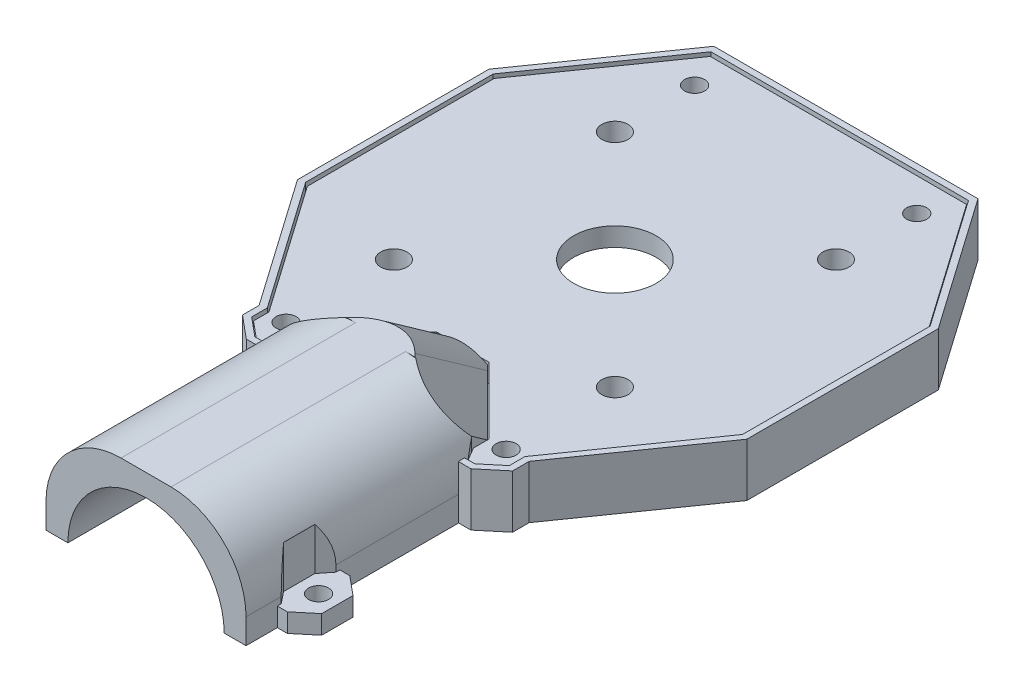
from build123d import *
from build123d.topology import SkipClean

# Parameters (mm, degrees)
BOSS_EXTRUDE1_DEPTH      = 40
BOSS_EXTRUDE3_DEPTH      = 3
CUT_EXTRUDE5_DEPTH       = 17
BOSS_EXTRUDE4_OUTLINE_R  = 1.6
BOSS_EXTRUDE4_DEPTH      = 5
CUT_EXTRUDE7_DEPTH       = 40
BOSS_EXTRUDE5_DEPTH      = 11
CUT_EXTRUDE8_DEPTH       = 3
BOSS_EXTRUDE7_DEPTH      = 3.5
BOSS_EXTRUDE7_DEPTH_BACK = 5
SKETCH13_R               = 1.6
SKETCH13_R_2             = 2.1
SKETCH13_R_3             = 6.6
BOSS_EXTRUDE8_DEPTH      = 3
CHAMFER1_SIZE            = 8.2
FILLET1_R                = 10
BOSS_EXTRUDE9_DEPTH      = 10


# Read off the part's stored shape, not the designer's step: Boss-Extrude4
with BuildPart() as part:
    # Sketch1 → Boss-Extrude1 (new body)
    with BuildSketch(Plane.XY):
        with BuildLine():
            ThreePointArc((-12.5, 0), (0, 12.5), (12.5, 0))
            Line((12.5, 0), (16, 0))
            Line((16, 0), (16, 4))
            ThreePointArc((16, 4), (12.485281374, 12.485281374), (4, 16))
            Line((4, 16), (-4, 16))
            ThreePointArc((-4, 16), (-12.485281374, 12.485281374), (-16, 4))
            Line((-16, 4), (-16, 0))
            Line((-16, 0), (-12.5, 0))
        make_face()
    extrude(amount=-BOSS_EXTRUDE1_DEPTH)

    # Sketch3 → Boss-Extrude3 (add)
    with SkipClean():  # the faces are left unmerged after this step: merging them gives an invalid solid
        with BuildSketch(Plane(origin=(0, 0, 0), x_dir=(1, 0, 0), z_dir=(0, 1, 0))):
            Polygon((16, 10.000000005), (16, 6.333333333), (16, 5), (17.6, 5), (20.6, 7.5), (20.6, 12.5), (17.6, 15), (16, 15), (16, 13.666666667), align=None)
            with BuildLine():
                ThreePointArc((19.2, 10), (17.599999997, 8.4), (16, 10.000000005))
                ThreePointArc((16, 10.000000005), (17.600000003, 11.6), (19.2, 10))
            make_face(mode=Mode.SUBTRACT)
        boss_extrude3 = extrude(amount=BOSS_EXTRUDE3_DEPTH)

    # Sketch5 → Cut-Extrude5 (cut)
    with BuildSketch(Plane(origin=(0, 3, 0), x_dir=(1, 0, 0), z_dir=(0, 1, 0))):
        Polygon((14.5, 7.5), (14.5, 12.5), (16.5, 15), (16.5, 5), align=None)
    cut_extrude5 = extrude(amount=CUT_EXTRUDE5_DEPTH, mode=Mode.SUBTRACT)

    # Boss-Extrude4 outline → Boss-Extrude4 (add)
    with BuildSketch(Plane(origin=(0, 0, 0), x_dir=(1, 0, 0), z_dir=(0, 1, 0))):
        Polygon((17.6, 35), (20.6, 37.5), (20.6, 40), (34.939410909, 60.478801107), (34.939410909, 90.478801107), (20.6, 110.957602214), (-20.6, 110.957602214), (-34.939410909, 90.478801107), (-34.939410909, 60.478801107), (-20.6, 40), (-20.6, 37.5), (-17.6, 35), (-14.6, 35), (-14.6, 40), (-12.6, 40), (-12.6, 37.5), (12.6, 37.5), (12.6, 40), (14.6, 40), (14.6, 35), align=None)
        with BuildLine():
            ThreePointArc((18.467882182, 45.672254166), (15.659662761, 44.238744593), (12.6, 45))
            Line((12.6, 45), (4.77640104, 52.82359896))
            Line((4.77640104, 52.82359896), (-4.77640104, 52.82359896))
            Line((-4.77640104, 52.82359896), (-12.6, 45))
            ThreePointArc((-12.6, 45), (-15.659662761, 44.238744593), (-18.467882182, 45.672254166))
            Line((-18.467882182, 45.672254166), (-29.939410909, 62.055295052))
            Line((-29.939410909, 62.055295052), (-29.939410909, 88.902307163))
            Line((-29.939410909, 88.902307163), (-19.947319679, 103.172492335))
            ThreePointArc((-19.947319679, 103.172492335), (-16.288694878, 102.675662132), (-14.59717338, 105.957602214))
            Line((-14.59717338, 105.957602214), (14.59717338, 105.957602214))
            ThreePointArc((14.59717338, 105.957602214), (16.288694878, 102.675662132), (19.947319679, 103.172492335))
            Line((19.947319679, 103.172492335), (29.939410909, 88.902307163))
            Line((29.939410909, 88.902307163), (29.939410909, 62.055295052))
            Line((29.939410909, 62.055295052), (18.467882182, 45.672254166))
        make_face(mode=Mode.SUBTRACT)
        with Locations((17.766290441, 105.514096798)):
            Circle(BOSS_EXTRUDE4_OUTLINE_R, mode=Mode.SUBTRACT)
        with Locations((-17.766290441, 105.514096798)):
            Circle(BOSS_EXTRUDE4_OUTLINE_R, mode=Mode.SUBTRACT)
        with Locations((17.6, 40)):
            Circle(BOSS_EXTRUDE4_OUTLINE_R, mode=Mode.SUBTRACT)
        with Locations((-17.6, 40)):
            Circle(BOSS_EXTRUDE4_OUTLINE_R, mode=Mode.SUBTRACT)
    extrude(amount=BOSS_EXTRUDE4_DEPTH)

    # Sketch7 → Cut-Extrude7 (cut)
    with BuildSketch(Plane(origin=(0, 5, 0), x_dir=(1, 0, 0), z_dir=(0, 1, 0))):
        Polygon((-16.1, 35), (-14.6, 37.5), (-14.6, 40), (-16.1, 40), align=None)
        Polygon((16.1, 40), (16.1, 35), (14.6, 37.5), (14.6, 40), align=None)
    extrude(amount=CUT_EXTRUDE7_DEPTH, mode=Mode.SUBTRACT)

    # Sketch8 → Boss-Extrude5 (add)
    with BuildSketch(Plane(origin=(0, 5, 0), x_dir=(1, 0, 0), z_dir=(0, 1, 0))):
        Polygon((-14.6, 40), (-4.1, 50.5), (4.1, 50.5), (14.6, 40), (14.6, 37.5), (-14.6, 37.5), align=None)
    extrude(amount=BOSS_EXTRUDE5_DEPTH)

    # Sketch9 → Cut-Extrude8 (cut)
    with BuildSketch(Plane.XY.offset(-37.5)):
        with BuildLine():
            Line((-12.5, 0), (12.5, 0))
            ThreePointArc((12.5, 0), (0, 12.5), (-12.5, 0))
        make_face()
    extrude(amount=-CUT_EXTRUDE8_DEPTH, mode=Mode.SUBTRACT)

    # Mirror1: Boss-Extrude3 across plane
    add(boss_extrude3.mirror(Plane(origin=(0, 0, 0), x_dir=(0, 0, 1), z_dir=(1, 0, 0))))

    # Mirror2: Cut-Extrude5 across plane
    add(cut_extrude5.mirror(Plane(origin=(0, 0, 0), x_dir=(0, 0, 1), z_dir=(1, 0, 0))), mode=Mode.SUBTRACT)

    # Sketch10 → Boss-Extrude7 (add, two sides: drawn at the far end of the back side and taken through both)
    with BuildSketch(Plane(origin=(0, 5, 0), x_dir=(1, 0, 0), z_dir=(0, 1, 0)).offset(-BOSS_EXTRUDE7_DEPTH_BACK)):
        Polygon((20.6, 110.957602214), (-20.6, 110.957602214), (-34.939410909, 90.478801107), (-34.939410909, 60.478801107), (-20.6, 40), (-20.6, 37.5), (-17.6, 35), (-15.958260743, 35), (-15.958260743, 34), (-17.962049935, 34), (-21.6, 37.031625054), (-21.6, 39.684701211), (-35.939410909, 60.163502318), (-35.939410909, 90.794099896), (-21.120567051, 111.957602214), (21.120567051, 111.957602214), (35.939410909, 90.794099896), (35.939410909, 60.163502318), (21.6, 39.684701211), (21.6, 37.031625054), (17.962049935, 34), (15.958260743, 34), (15.958260743, 35), (17.6, 35), (20.6, 37.5), (20.6, 40), (34.939410909, 60.478801107), (34.939410909, 90.478801107), align=None)
    extrude(amount=BOSS_EXTRUDE7_DEPTH + BOSS_EXTRUDE7_DEPTH_BACK)

    # Chamfer1
    # the kernel refuses this chamfer: 8.2 mm, written as the material it takes off along each edge
    with BuildSketch(Plane(origin=(-29.511326735, 16, -25.088673265), x_dir=(0.7068394360706735, 0.0274958766105863, 0.7068394360706736), z_dir=(0.7071067811865477, 0, -0.7071067811865474))) as chamfer1_piece_1_section:
        Polygon((CHAMFER1_SIZE * 0.999621916911, CHAMFER1_SIZE * 0.0274958766106), (-CHAMFER1_SIZE * 0.0274958766106, CHAMFER1_SIZE * 0.999621916911), (0, 0), align=None)
    chamfer1_piece_1 = extrude(amount=57.024843408, mode=Mode.PRIVATE)
    chamfer1_piece_1 = split(chamfer1_piece_1, bisect_by=Plane(origin=(-17.047681799, 9.599219571, -34.539734833), z_dir=(0.6401843996644793, 0, -0.7682212795973764)), keep=Keep.TOP, mode=Mode.PRIVATE)
    add(chamfer1_piece_1, mode=Mode.SUBTRACT)
    with BuildSketch(Plane(origin=(-10.811326735, 16, -65.411326735), x_dir=(-0.7068394360706771, 0.027495876610586303, 0.70683943607067), z_dir=(0.707106781186544, 0, 0.7071067811865511))) as chamfer1_piece_2_section:
        Polygon((CHAMFER1_SIZE * 0.999621916911, CHAMFER1_SIZE * 0.0274958766106), (-CHAMFER1_SIZE * 0.0274958766106, CHAMFER1_SIZE * 0.999621916911), (0, 0), align=None)
    chamfer1_piece_2 = extrude(amount=57.024843408, mode=Mode.PRIVATE)
    chamfer1_piece_2 = split(chamfer1_piece_2, bisect_by=Plane(origin=(12.661566883, 15.409832757, -30.884639069), z_dir=(-0.6401843996644799, 0, -0.7682212795973759)), keep=Keep.TOP, mode=Mode.PRIVATE)
    add(chamfer1_piece_2, mode=Mode.SUBTRACT)

    # Fillet1
    fillet1_edges = [part.edges().sort_by_distance(p)[0] for p in [
        (0, 13.349568901, -46.751724394),
    ]]
    fillet(fillet1_edges, radius=FILLET1_R)

    # Sketch14 → Boss-Extrude9 (add)
    with BuildSketch(Plane.XY.offset(-40.5)):
        with BuildLine():
            ThreePointArc((11, 0), (0, 11), (-11, 0))
            Line((-11, 0), (11, 0))
        make_face()
    extrude(amount=BOSS_EXTRUDE9_DEPTH)


with BuildPart() as body_2:
    # Sketch13 → Boss-Extrude8 (new body)
    with BuildSketch(Plane(origin=(0, 5, 0), x_dir=(1, 0, 0), z_dir=(0, 1, 0))):
        Polygon((-20.49588659, 110.757602214), (-34.739410909, 90.415741349), (-34.739410909, 60.541860865), (-20.4, 40.063059758), (-20.4, 37.593674989), (-17.527590013, 35.2), (-16.158260743, 35.2), (-16.158260743, 35.291628888), (-14.8, 37.555396793), (-14.8, 40.082842712), (-4.182842712, 50.7), (4.182842712, 50.7), (14.8, 40.082842712), (14.8, 37.555396793), (16.158260743, 35.291628888), (16.158260743, 35.2), (17.527590013, 35.2), (20.4, 37.593674989), (20.4, 40.063059758), (34.739410909, 60.541860865), (34.739410909, 90.415741349), (20.49588659, 110.757602214), align=None)
        with Locations(Location((17.6, 40, 0), (0, 0, 270))):
            Circle(SKETCH13_R, mode=Mode.SUBTRACT)
        with Locations(Location((-17.6, 40, 0), (0, 0, 270))):
            Circle(SKETCH13_R, mode=Mode.SUBTRACT)
        with Locations(Location((-17.67766953, 57.32233047, 0), (0, 0, 270))):
            Circle(SKETCH13_R_2, mode=Mode.SUBTRACT)
        with Locations(Location((17.67766953, 57.32233047, 0), (0, 0, 270))):
            Circle(SKETCH13_R_2, mode=Mode.SUBTRACT)
        with Locations(Location((17.67766953, 92.67766953, 0), (0, 0, 270))):
            Circle(SKETCH13_R_2, mode=Mode.SUBTRACT)
        with Locations(Location((17.766290441, 105.514096798, 0), (0, 0, 270))):
            Circle(SKETCH13_R, mode=Mode.SUBTRACT)
        with Locations(Location((-17.766290441, 105.514096798, 0), (0, 0, 270))):
            Circle(SKETCH13_R, mode=Mode.SUBTRACT)
        with Locations(Location((-17.67766953, 92.67766953, 0), (0, 0, 270))):
            Circle(SKETCH13_R_2, mode=Mode.SUBTRACT)
        with Locations(Location((0, 75, 0), (0, 0, 270))):
            Circle(SKETCH13_R_3, mode=Mode.SUBTRACT)
    extrude(amount=BOSS_EXTRUDE8_DEPTH)


solid = Compound([part.part, body_2.part])
